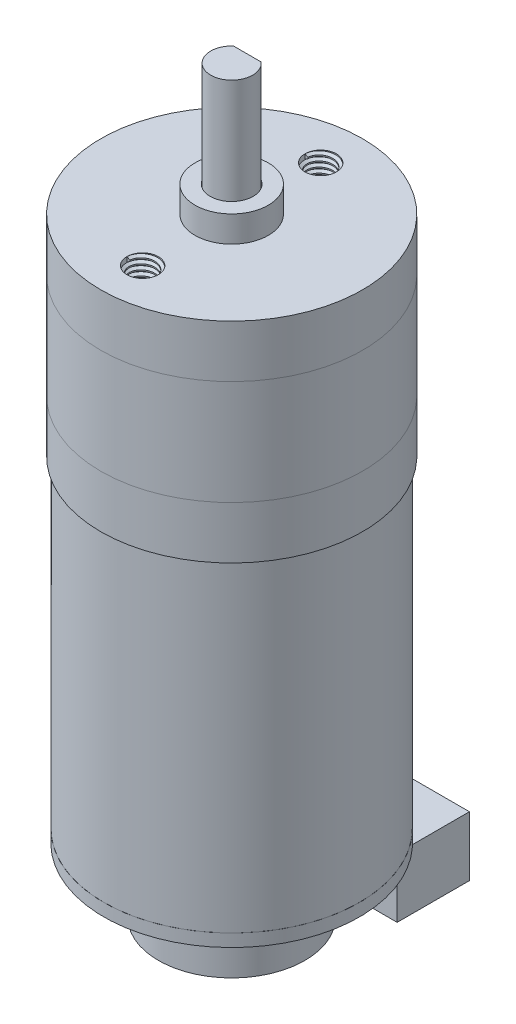
from build123d import *
from build123d.topology import SkipClean

# Parameters (mm, degrees)
SKETCH1_R                = 12.5
BOSS_EXTRUDE1_DEPTH      = 5
BOSS_EXTRUDE2_START      = -5
SKETCH1_2_R              = 12.5
BOSS_EXTRUDE2_DEPTH      = 10
BOSS_EXTRUDE3_START      = -15
SKETCH1_3_R              = 12.5
BOSS_EXTRUDE3_DEPTH      = 5
SKETCH5_R                = 1.5
CUT_EXTRUDE2_DEPTH       = 4.5
THREAD1_PITCH            = 0.5
THREAD2_PITCH            = 0.5
BOSS_EXTRUDE4_DEPTH      = 12.5
BOSS_EXTRUDE4_DEPTH_BACK = 60
SKETCH2_R                = 2
SKETCH3_W                = 4
SKETCH3_H                = 1
CUT_EXTRUDE1_DEPTH       = 7.5
SKETCH4_R                = 3.5
SKETCH4_R_2              = 2.05
BOSS_EXTRUDE5_DEPTH      = 2.5
SKETCH11_R               = 12.2
MOTOR_DEPTH              = 30.8
SKETCH12_R               = 12.21
BOSS_EXTRUDE7_DEPTH      = 1.2
SKETCH13_W               = 17.5
SKETCH13_H               = 6.9
BOSS_EXTRUDE8_DEPTH      = 5.7
BOSS_EXTRUDE9_START      = 0.2
SKETCH14_R               = 7
SKETCH14_R_2             = 2.05
BOSS_EXTRUDE9_DEPTH      = 6
SKETCH15_W               = 16.5
SKETCH15_H               = 4.495654016
SKETCH15_W_2             = 1.5
SKETCH15_H_2             = 0.602172992
CUT_EXTRUDE3_DEPTH       = 5
SKETCH16_W               = 0.62
SKETCH16_H               = 0.62
BOSS_EXTRUDE10_DEPTH     = 4
BOSS_EXTRUDE10_2_DEPTH   = 4
BOSS_EXTRUDE10_3_DEPTH   = 4
BOSS_EXTRUDE10_4_DEPTH   = 4
BOSS_EXTRUDE10_5_DEPTH   = 4
BOSS_EXTRUDE10_6_DEPTH   = 4


with BuildPart() as part:
    # Sketch1 → Boss-Extrude1 (new body)
    with BuildSketch(Plane(origin=(0, 0, 0), x_dir=(1, 0, 0), z_dir=(0, 1, 0))):
        with Locations(Location((0, 0, 0), (0, 0, 270))):
            Circle(SKETCH1_R)
    extrude(amount=-BOSS_EXTRUDE1_DEPTH)

    # Sketch5 → Cut-Extrude2 (cut)
    with BuildSketch(Plane(origin=(0, 0, 0), x_dir=(1, 0, 0), z_dir=(0, 1, 0))):
        with Locations(Location((0, 8.5, 0), (0, 0, 270))):
            Circle(SKETCH5_R)
        with Locations(Location((0, -8.5, 0), (0, 0, 270))):
            Circle(SKETCH5_R)
    extrude(amount=-CUT_EXTRUDE2_DEPTH, mode=Mode.SUBTRACT)

    # Thread1: arcs per turn and ends read off the stored shape
    # Thread1: the profile of Thread Profile1 profile screwed along a right-hand helix through 9 turns, 6 arcs to a turn; built about Z, then put on its axis
    with SkipClean():  # the faces are left unmerged after this step: merging them gives an invalid solid
        thread1_z = Axis((0, 0, 0), (0, 0, 1))
        thread1_corners = [(1.5003, 0, -0.000173205), (1.5003, 0, 0.437673204), (1.229367063, 0, 0.281249999), (1.229367062, 0, 0.156249999)]
        with BuildLine(mode=Mode.PRIVATE) as thread1_profile:
            Line(thread1_corners[0], thread1_corners[1])
            Line(thread1_corners[1], thread1_corners[2])
            Line(thread1_corners[2], thread1_corners[3])
            Line(thread1_corners[3], thread1_corners[0])
        thread1_cap = Face(thread1_profile.wire())
        thread1_turn_angles = [0, 30, 60, 90, 120, 150, 180, 210, 240, 270, 300, 330, 360]
        thread1_turn_weights = [1, 0.8660254037844387, 1, 0.8660254037844387, 1, 0.8660254037844387, 1, 0.8660254037844387, 1, 0.8660254037844387, 1, 0.8660254037844387, 1]
        thread1_turn_rails = [Edge.make_bspline([Vector(p[0], p[1], 0).rotate(thread1_z, thread1_turn_angles[k]) / thread1_turn_weights[k] + Vector(0, 0, p[2] + THREAD1_PITCH * thread1_turn_angles[k] / 360) for k in range(13)], [0, 0, 0, 1, 1, 2, 2, 3, 3, 4, 4, 5, 5, 6, 6, 6], 2, thread1_turn_weights) for p in thread1_corners]
        thread1_turn_sides = [Face.make_surface_from_curves(thread1_turn_rails[p[0]], thread1_turn_rails[p[1]]) for p in [(0, 1), (1, 2), (2, 3), (3, 0)]]
        thread1 = Plane(origin=(0, 0, -8.5), x_dir=(-1, 0, 0), z_dir=(0, -1, 0)) * Solid(Shell([*[p.moved(Location((0, 0, THREAD1_PITCH * i))) for i in range(9) for p in thread1_turn_sides], thread1_cap, thread1_cap.rotate(thread1_z, 3240).moved(Location((0, 0, THREAD1_PITCH * 3240 / 360)))]))
        add(thread1)

    # Thread2: arcs per turn and ends read off the stored shape
    # Thread2: the profile of Thread Profile2 profile screwed along a right-hand helix through 9 turns, 6 arcs to a turn; built about Z, then put on its axis
    with SkipClean():  # the faces are left unmerged after this step: merging them gives an invalid solid
        thread2_z = Axis((0, 0, 0), (0, 0, 1))
        thread2_corners = [(1.5003, 0, -0.000173205), (1.5003, 0, 0.437673204), (1.229367063, 0, 0.281249999), (1.229367062, 0, 0.156249999)]
        with BuildLine(mode=Mode.PRIVATE) as thread2_profile:
            Line(thread2_corners[0], thread2_corners[1])
            Line(thread2_corners[1], thread2_corners[2])
            Line(thread2_corners[2], thread2_corners[3])
            Line(thread2_corners[3], thread2_corners[0])
        thread2_cap = Face(thread2_profile.wire())
        thread2_turn_angles = [0, 30, 60, 90, 120, 150, 180, 210, 240, 270, 300, 330, 360]
        thread2_turn_weights = [1, 0.8660254037844387, 1, 0.8660254037844387, 1, 0.8660254037844387, 1, 0.8660254037844387, 1, 0.8660254037844387, 1, 0.8660254037844387, 1]
        thread2_turn_rails = [Edge.make_bspline([Vector(p[0], p[1], 0).rotate(thread2_z, thread2_turn_angles[k]) / thread2_turn_weights[k] + Vector(0, 0, p[2] + THREAD2_PITCH * thread2_turn_angles[k] / 360) for k in range(13)], [0, 0, 0, 1, 1, 2, 2, 3, 3, 4, 4, 5, 5, 6, 6, 6], 2, thread2_turn_weights) for p in thread2_corners]
        thread2_turn_sides = [Face.make_surface_from_curves(thread2_turn_rails[p[0]], thread2_turn_rails[p[1]]) for p in [(0, 1), (1, 2), (2, 3), (3, 0)]]
        thread2 = Plane(origin=(0, 0, 8.5), x_dir=(-1, 0, 0), z_dir=(0, -1, 0)) * Solid(Shell([*[p.moved(Location((0, 0, THREAD2_PITCH * i))) for i in range(9) for p in thread2_turn_sides], thread2_cap, thread2_cap.rotate(thread2_z, 3240).moved(Location((0, 0, THREAD2_PITCH * 3240 / 360)))]))
        add(thread2)


with BuildPart() as body_2:
    # Sketch1<2> → Boss-Extrude2 (new body)
    with BuildSketch(Plane(origin=(0, 0, 0), x_dir=(1, 0, 0), z_dir=(0, 1, 0)).offset(BOSS_EXTRUDE2_START)):
        with Locations(Location((0, 0, 0), (0, 0, 270))):
            Circle(SKETCH1_2_R)
    extrude(amount=-BOSS_EXTRUDE2_DEPTH)


with BuildPart() as body_3:
    # Sketch1<3> → Boss-Extrude3 (new body)
    with BuildSketch(Plane(origin=(0, 0, 0), x_dir=(1, 0, 0), z_dir=(0, 1, 0)).offset(BOSS_EXTRUDE3_START)):
        with Locations(Location((0, 0, 0), (0, 0, 270))):
            Circle(SKETCH1_3_R)
    extrude(amount=-BOSS_EXTRUDE3_DEPTH)


with BuildPart() as body_4:
    # Sketch2 → Boss-Extrude4 (new, two sides: drawn at the far end of the back side and taken through both)
    with BuildSketch(Plane(origin=(0, 0, 0), x_dir=(1, 0, 0), z_dir=(0, 1, 0)).offset(-BOSS_EXTRUDE4_DEPTH_BACK)):
        with Locations(Location((0, 0, 0), (0, 0, 270))):
            Circle(SKETCH2_R)
    extrude(amount=BOSS_EXTRUDE4_DEPTH + BOSS_EXTRUDE4_DEPTH_BACK)

    # Sketch3 → Cut-Extrude1 (cut)
    with BuildSketch(Plane(origin=(0, 12.5, 0), x_dir=(1, 0, 0), z_dir=(0, 1, 0))):
        with Locations((0, 2)):
            Rectangle(SKETCH3_W, SKETCH3_H)
    extrude(amount=-CUT_EXTRUDE1_DEPTH, mode=Mode.SUBTRACT)


with BuildPart() as body_5:
    # Sketch4 → Boss-Extrude5 (new body)
    with BuildSketch(Plane(origin=(0, 0, 0), x_dir=(1, 0, 0), z_dir=(0, 1, 0))):
        with Locations(Location((0, 0, 0), (0, 0, 270))):
            Circle(SKETCH4_R)
        with Locations(Location((0, 0, 0), (0, 0, 270))):
            Circle(SKETCH4_R_2, mode=Mode.SUBTRACT)
    extrude(amount=BOSS_EXTRUDE5_DEPTH)


with BuildPart() as body_6:
    # Sketch11 → Motor (new body)
    with BuildSketch(Plane.XZ.offset(20)):
        with Locations(Location((0, 0, 0), (0, 0, 90))):
            Circle(SKETCH11_R)
    extrude(amount=MOTOR_DEPTH)


with BuildPart() as body_7:
    # Sketch12 → Boss-Extrude7 (new body)
    with BuildSketch(Plane.XZ.offset(50.8)):
        with Locations(Location((0, 0, 0), (0, 0, 270))):
            Circle(SKETCH12_R)
    extrude(amount=BOSS_EXTRUDE7_DEPTH)


with BuildPart() as body_8:
    # Sketch13 → Boss-Extrude8 (new body)
    with BuildSketch(Plane.XZ.offset(52)):
        with Locations((0, -10.5)):
            Rectangle(SKETCH13_W, SKETCH13_H)
    extrude(amount=BOSS_EXTRUDE8_DEPTH)

    # Sketch15 → Cut-Extrude3 (cut)
    with BuildSketch(Plane(origin=(0, 0, -13.95), x_dir=(-1, 0, 0), z_dir=(0, 0, -1))):
        with Locations((0, -54.85)):
            Rectangle(SKETCH15_W, SKETCH15_H)
        with Locations((6.5, -57.398913504)):
            Rectangle(SKETCH15_W_2, SKETCH15_H_2)
        with Locations((-6.5, -57.398913504)):
            Rectangle(SKETCH15_W_2, SKETCH15_H_2)
    extrude(amount=-CUT_EXTRUDE3_DEPTH, mode=Mode.SUBTRACT)


with BuildPart() as body_9:
    # Sketch14 → Boss-Extrude9 (new body)
    with BuildSketch(Plane.XZ.offset(52).offset(BOSS_EXTRUDE9_START)):
        with Locations(Location((0, 0, 0), (0, 0, 270))):
            Circle(SKETCH14_R)
        with Locations(Location((0, 0, 0), (0, 0, 270))):
            Circle(SKETCH14_R_2, mode=Mode.SUBTRACT)
    extrude(amount=BOSS_EXTRUDE9_DEPTH)


with BuildPart() as body_10:
    # Sketch16 → Boss-Extrude10 (new body)
    with BuildSketch(Plane(origin=(0, 0, -8.95), x_dir=(-1, 0, 0), z_dir=(0, 0, -1))):
        with Locations((3.75, -55.097827008)):
            Rectangle(SKETCH16_W, SKETCH16_H)
    extrude(amount=BOSS_EXTRUDE10_DEPTH)


with BuildPart() as body_11:
    # Sketch16 → Boss-Extrude10 2 (new body)
    with BuildSketch(Plane(origin=(0, 0, -8.95), x_dir=(-1, 0, 0), z_dir=(0, 0, -1))):
        with Locations((1.25, -55.097827008)):
            Rectangle(SKETCH16_W, SKETCH16_H)
    extrude(amount=BOSS_EXTRUDE10_2_DEPTH)


with BuildPart() as body_12:
    # Sketch16 → Boss-Extrude10 3 (new body)
    with BuildSketch(Plane(origin=(0, 0, -8.95), x_dir=(-1, 0, 0), z_dir=(0, 0, -1))):
        with Locations((6.25, -55.097827008)):
            Rectangle(SKETCH16_W, SKETCH16_H)
    extrude(amount=BOSS_EXTRUDE10_3_DEPTH)


with BuildPart() as body_13:
    # Sketch16 → Boss-Extrude10 4 (new body)
    with BuildSketch(Plane(origin=(0, 0, -8.95), x_dir=(-1, 0, 0), z_dir=(0, 0, -1))):
        with Locations((-1.25, -55.097827008)):
            Rectangle(SKETCH16_W, SKETCH16_H)
    extrude(amount=BOSS_EXTRUDE10_4_DEPTH)


with BuildPart() as body_14:
    # Sketch16 → Boss-Extrude10 5 (new body)
    with BuildSketch(Plane(origin=(0, 0, -8.95), x_dir=(-1, 0, 0), z_dir=(0, 0, -1))):
        with Locations((-3.75, -55.097827008)):
            Rectangle(SKETCH16_W, SKETCH16_H)
    extrude(amount=BOSS_EXTRUDE10_5_DEPTH)


with BuildPart() as body_15:
    # Sketch16 → Boss-Extrude10 6 (new body)
    with BuildSketch(Plane(origin=(0, 0, -8.95), x_dir=(-1, 0, 0), z_dir=(0, 0, -1))):
        with Locations((-6.25, -55.097827008)):
            Rectangle(SKETCH16_W, SKETCH16_H)
    extrude(amount=BOSS_EXTRUDE10_6_DEPTH)


solid = Compound([part.part, body_2.part, body_3.part, body_4.part, body_5.part, body_6.part, body_7.part, body_8.part, body_9.part, body_10.part, body_11.part, body_12.part, body_13.part, body_14.part, body_15.part])
